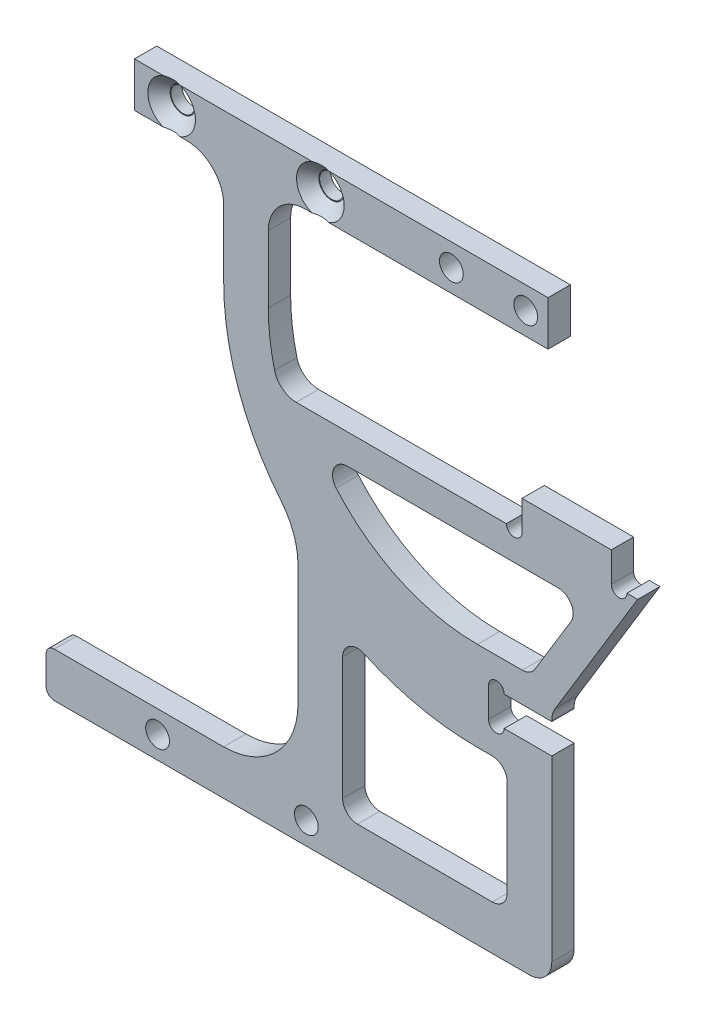
from build123d import *

# Parameters (mm, degrees)
EXTRUDE_1_DEPTH       = 3
EXTRUDE_START         = -3
SKETCH_2_W            = 40
SKETCH_2_H            = 6
EXTRUDE_2_DEPTH       = 3
EXTRUDE_3_DEPTH       = 3
EXTRUDE_4_DEPTH       = 3
CUT_EXTRUDE_1_DEPTH   = 10
SKETCH_7_W            = 12
SKETCH_7_H            = 4
EXTRUDE_5_DEPTH       = 3
SKETCH_8_R            = 1.05
CUT_EXTRUDE_2_DEPTH   = 10
SKETCH_9_W            = 26
SKETCH_9_H            = 6
EXTRUDE_6_DEPTH       = 3
SKETCH_10_R           = 1.6
CUT_EXTRUDE_3_DEPTH   = 10
SKETCH_14_W           = 18
SKETCH_14_H           = 6
EXTRUDE_7_DEPTH       = 3
SKETCH_15_R           = 1.6
CUT_EXTRUDE_4_DEPTH   = 10
FILLET_2_R            = 3
FILLET_3_R            = 3
FILLET_4_R            = 3
FILLET_5_R            = 10
FILLET_6_R            = 1.1
CUT_EXTRUDE_7_DEPTH   = 10
FILLET_8_R            = 2
SKETCH_17_W           = 5.387301628
SKETCH_17_H           = 6
CUT_EXTRUDE_8_DEPTH   = 10
SKETCH_18_W           = 31
SKETCH_18_H           = 6
EXTRUDE_8_DEPTH       = 3
SKETCH_19_R           = 1.6
CUT_EXTRUDE_9_DEPTH   = 10
OTHER_1_OUTLINE_R     = 1.7
OTHER_1_OUTLINE_R_2   = 1.6
OTHER_1_DEPTH         = 1.5
OTHER_1_DRAFT         = -45
OTHER_1_2_OUTLINE_R   = 1.7
OTHER_1_2_OUTLINE_R_2 = 1.6
OTHER_1_2_DEPTH       = 1.5
OTHER_1_2_DRAFT       = -45
SKETCH_23_W           = 5
SKETCH_23_H           = 6
CUT_EXTRUDE_10_DEPTH  = 10
FILLET_9_R            = 5


# Read off the part's stored shape, not the designer's step: 高级异型孔1
with BuildPart() as part:
    # 草图1 → 凸台-拉伸1 (new body)
    with BuildSketch(Plane.XY):
        with BuildLine():
            Line((0, -28.112698372), (10, -28.112698372))
            Line((10, -28.112698372), (10, -34.112698372))
            Line((10, -34.112698372), (0, -34.112698372))
            ThreePointArc((0, -34.112698372), (-24.121320344, -24.121320344), (-34.112698372, 0))
            Line((-34.112698372, 0), (-34.112698372, 20))
            Line((-34.112698372, 20), (-28.112698372, 20))
            Line((-28.112698372, 20), (-28.112698372, 0))
            ThreePointArc((-28.112698372, 0), (-19.878679656, -19.878679656), (0, -28.112698372))
        make_face()
    extrude(amount=EXTRUDE_1_DEPTH)

    # 草图2 → 凸台-拉伸2 (add)
    with BuildSketch(Plane.XY.offset(3).offset(EXTRUDE_START)):
        with BuildLine():
            Line((-24.121320344, -24.121320344), (-24.121320344, -54.112698372))
            Line((-24.121320344, -54.112698372), (-40, -54.112698372))
            Line((-40, -54.112698372), (-40, -60.112698372))
            Line((-40, -60.112698372), (10, -60.112698372))
            Line((10, -60.112698372), (10, -54.112698372))
            Line((10, -54.112698372), (-18.121320344, -54.112698372))
            Line((-18.121320344, -54.112698372), (-18.121320344, -28.901452199))
            ThreePointArc((-18.121320344, -28.901452199), (-21.256118841, -26.680584739), (-24.121320344, -24.121320344))
        make_face()
        with Locations((-31.112698372, 17)):
            Rectangle(SKETCH_2_W, SKETCH_2_H)
    extrude(amount=EXTRUDE_2_DEPTH)

    # 草图4 → 凸台-拉伸3 (add)
    with BuildSketch(Plane(origin=(0, 0, 0), x_dir=(-1, 0, 0), z_dir=(0, 0, -1))):
        with BuildLine():
            Line((-10, -28.112698372), (-21.546473969, -9.112698372))
            Line((-21.546473969, -9.112698372), (26.59478404, -9.112698372))
            ThreePointArc((26.59478404, -9.112698372), (16.342295877, -22.874727872), (0, -28.112698372))
            Line((0, -28.112698372), (-10, -28.112698372))
        make_face()
    extrude(amount=-EXTRUDE_3_DEPTH)

    # 草图6 → 凸台-拉伸4 (add)
    with BuildSketch(Plane.XY.offset(3).offset(EXTRUDE_START)):
        with BuildLine():
            Line((10, -34.112698372), (10, -54.112698372))
            Line((10, -54.112698372), (-18.121320344, -54.112698372))
            Line((-18.121320344, -54.112698372), (-18.121320344, -28.901452199))
            ThreePointArc((-18.121320344, -28.901452199), (-9.427875393, -32.784010673), (0, -34.112698372))
            Line((0, -34.112698372), (10, -34.112698372))
        make_face()
    extrude(amount=EXTRUDE_4_DEPTH)

    # 草图3 → 切除-拉伸1 (cut)
    with BuildSketch(Plane(origin=(0, 0, 0), x_dir=(-1, 0, 0), z_dir=(0, 0, -1))):
        with BuildLine():
            Line((-3.6, -29.112698372), (-10, -29.112698372))
            Line((-10, -29.112698372), (-10, -33.112698372))
            Line((-10, -33.112698372), (-3.6, -33.112698372))
            ThreePointArc((-3.6, -33.112698372), (-2.55, -34.162698372), (-1.5, -33.112698372))
            Line((-1.5, -33.112698372), (-1.5, -29.112698372))
            ThreePointArc((-1.5, -29.112698372), (-2.55, -28.062698372), (-3.6, -29.112698372))
        make_face()
    extrude(amount=-CUT_EXTRUDE_1_DEPTH, mode=Mode.SUBTRACT)

    # 草图7 → 凸台-拉伸5 (add)
    with BuildSketch(Plane(origin=(0, 0, 0), x_dir=(-1, 0, 0), z_dir=(0, 0, -1))):
        with Locations((-12, -7.112698372)):
            Rectangle(SKETCH_7_W, SKETCH_7_H)
    extrude(amount=-EXTRUDE_5_DEPTH)

    # 草图8 → 切除-拉伸2 (cut)
    with BuildSketch(Plane(origin=(0, 0, 0), x_dir=(-1, 0, 0), z_dir=(0, 0, -1))):
        with Locations((-4.95, -9.112698372)):
            Circle(SKETCH_8_R)
        with Locations((-19.05, -9.112698372)):
            Circle(SKETCH_8_R)
    extrude(amount=-CUT_EXTRUDE_2_DEPTH, mode=Mode.SUBTRACT)

    # 草图9 → 凸台-拉伸6 (add)
    with BuildSketch(Plane(origin=(0, 0, 0), x_dir=(-1, 0, 0), z_dir=(0, 0, -1))):
        with Locations((-1.887301628, 17)):
            Rectangle(SKETCH_9_W, SKETCH_9_H)
    extrude(amount=-EXTRUDE_6_DEPTH)

    # 草图10 → 切除-拉伸3 (cut)
    with BuildSketch(Plane(origin=(0, 0, 0), x_dir=(-1, 0, 0), z_dir=(0, 0, -1))):
        with Locations((41.112698372, 17)):
            Circle(SKETCH_10_R)
        with Locations((21.112698372, 17)):
            Circle(SKETCH_10_R)
        with Locations((3.5, 17)):
            Circle(SKETCH_10_R)
        with Locations((-6.5, 17)):
            Circle(SKETCH_10_R)
    extrude(amount=-CUT_EXTRUDE_3_DEPTH, mode=Mode.SUBTRACT)

    # 草图14 → 凸台-拉伸7 (add)
    with BuildSketch(Plane(origin=(0, 0, 0), x_dir=(-1, 0, 0), z_dir=(0, 0, -1))):
        with Locations((49, -57.112698372)):
            Rectangle(SKETCH_14_W, SKETCH_14_H)
    extrude(amount=-EXTRUDE_7_DEPTH)

    # 草图15 → 切除-拉伸4 (cut)
    with BuildSketch(Plane(origin=(0, 0, 0), x_dir=(-1, 0, 0), z_dir=(0, 0, -1))):
        with Locations((43, -57.112698372)):
            Circle(SKETCH_15_R)
        with Locations((23, -57.112698372)):
            Circle(SKETCH_15_R)
    extrude(amount=-CUT_EXTRUDE_4_DEPTH, mode=Mode.SUBTRACT)

    # 圆角2
    fillet_2_edges = [part.edges().sort_by_distance(p)[0] for p in [
        (-26.59478404, -9.112698372, 1.5),
    ]]
    fillet(fillet_2_edges, radius=FILLET_2_R)

    # 圆角3
    fillet_3_edges = [part.edges().sort_by_distance(p)[0] for p in [
        (10, -28.112698372, 1.5),
    ]]
    fillet(fillet_3_edges, radius=FILLET_3_R)

    # 圆角4
    fillet_4_edges = [part.edges().sort_by_distance(p)[0] for p in [
        (10, -60.112698372, 1.5),
    ]]
    fillet(fillet_4_edges, radius=FILLET_4_R)

    # 圆角5
    fillet_5_edges = [part.edges().sort_by_distance(p)[0] for p in [
        (-24.121320344, -24.121320344, 1.5),
        (-24.121320344, -54.112698372, 1.5),
    ]]
    fillet(fillet_5_edges, radius=FILLET_5_R)

    # 圆角6
    fillet_6_edges = [part.edges().sort_by_distance(p)[0] for p in [
        (-58, -60.112698372, 1.5),
        (-58, -54.112698372, 1.5),
    ]]
    fillet(fillet_6_edges, radius=FILLET_6_R)

    # 草图16 → 切除-拉伸7 (cut)
    with BuildSketch(Plane(origin=(0, 0, 0), x_dir=(-1, 0, 0), z_dir=(0, 0, -1))):
        with BuildLine():
            Line((-4, -37.112698372), (0, -37.112698372))
            ThreePointArc((0, -37.112698372), (9.363584206, -35.912054679), (18.121320344, -32.387808346))
            Line((18.121320344, -32.387808346), (18.121320344, -54.112698372))
            Line((18.121320344, -54.112698372), (-4, -54.112698372))
            Line((-4, -54.112698372), (-4, -37.112698372))
        make_face()
        with BuildLine():
            Line((-7.142425951, -25.112698372), (0, -25.112698372))
            ThreePointArc((0, -25.112698372), (12.275023024, -21.908250256), (21.417393888, -13.112698372))
            Line((21.417393888, -13.112698372), (-14.434935826, -13.112698372))
            Line((-14.434935826, -13.112698372), (-7.142425951, -25.112698372))
        make_face()
    extrude(amount=-CUT_EXTRUDE_7_DEPTH, mode=Mode.SUBTRACT)

    # 圆角8
    fillet_8_edges = [part.edges().sort_by_distance(p)[0] for p in [
        (4, -54.112698372, 1.5),
        (4, -37.112698372, 1.5),
        (-18.121320344, -32.387808346, 1.5),
        (-18.121320344, -54.112698372, 1.5),
        (-21.417393888, -13.112698372, 1.5),
        (7.142425951, -25.112698372, 1.5),
        (14.434935826, -13.112698372, 1.5),
    ]]
    fillet(fillet_8_edges, radius=FILLET_8_R)

    # 草图17 → 切除-拉伸8 (cut)
    with BuildSketch(Plane(origin=(0, 0, 0), x_dir=(-1, 0, 0), z_dir=(0, 0, -1))):
        with Locations((-12.193650814, 17)):
            Rectangle(SKETCH_17_W, SKETCH_17_H)
    extrude(amount=-CUT_EXTRUDE_8_DEPTH, mode=Mode.SUBTRACT)

    # 草图18 → 凸台-拉伸8 (add)
    with BuildSketch(Plane(origin=(0, 0, 0), x_dir=(-1, 0, 0), z_dir=(0, 0, -1))):
        with Locations((31.612698372, 17)):
            Rectangle(SKETCH_18_W, SKETCH_18_H)
    extrude(amount=-EXTRUDE_8_DEPTH)

    # 草图19 → 切除-拉伸9 (cut)
    with BuildSketch(Plane(origin=(0, 0, 0), x_dir=(-1, 0, 0), z_dir=(0, 0, -1))):
        with Locations((21.112698372, 17)):
            Circle(SKETCH_19_R)
        with Locations((41.112698372, 17)):
            Circle(SKETCH_19_R)
    extrude(amount=-CUT_EXTRUDE_9_DEPTH, mode=Mode.SUBTRACT)


with BuildPart() as other_1_tool:
    # 高级异型孔1 outline → 高级异型孔1 (with draft: the straight prism first)
    with BuildSketch(Plane.XY.offset(1.5)):
        with Locations((-21.112698372, 17)):
            Circle(OTHER_1_OUTLINE_R)
        with Locations((-21.112698372, 17)):
            Circle(OTHER_1_OUTLINE_R_2, mode=Mode.SUBTRACT)
    extrude(amount=OTHER_1_DEPTH)
    # 高级异型孔1: the draft: its side faces are tilted about the plane it starts from
    other_1_sides = [other_1_tool.faces().sort_by_distance(p)[0] for p in [
        (-22.812698372, 17, 2.25),
        (-22.712698372, 17, 2.25),
    ]]
    draft(other_1_sides, Plane.XY.offset(1.5), OTHER_1_DRAFT)


with BuildPart() as part_1:
    add(part.part)

    # 高级异型孔1: cut by other_1_tool
    add(other_1_tool.part, mode=Mode.SUBTRACT)


with BuildPart() as other_1_2_tool:
    # Other 1 2 outline → Other 1 2 (with draft: the straight prism first)
    with BuildSketch(Plane.XY.offset(1.5)):
        with Locations((-41.112698372, 17)):
            Circle(OTHER_1_2_OUTLINE_R)
        with Locations((-41.112698372, 17)):
            Circle(OTHER_1_2_OUTLINE_R_2, mode=Mode.SUBTRACT)
    extrude(amount=OTHER_1_2_DEPTH)
    # Other 1 2: the draft: its side faces are tilted about the plane it starts from
    other_1_2_sides = [other_1_2_tool.faces().sort_by_distance(p)[0] for p in [
        (-42.812698372, 17, 2.25),
        (-42.712698372, 17, 2.25),
    ]]
    draft(other_1_2_sides, Plane.XY.offset(1.5), OTHER_1_2_DRAFT)


with BuildPart() as part_2:
    add(part_1.part)

    # Other 1 2: cut by other_1_2_tool
    add(other_1_2_tool.part, mode=Mode.SUBTRACT)

    # 草图23 → 切除-拉伸10 (cut)
    with BuildSketch(Plane(origin=(0, 0, 0), x_dir=(-1, 0, 0), z_dir=(0, 0, -1))):
        with Locations((48.612698372, 17)):
            Rectangle(SKETCH_23_W, SKETCH_23_H)
    extrude(amount=-CUT_EXTRUDE_10_DEPTH, mode=Mode.SUBTRACT)

    # 圆角9
    fillet_9_edges = [part_2.edges().sort_by_distance(p)[0] for p in [
        (-28.112698372, 14, 1.5),
        (-34.112698372, 14, 1.5),
    ]]
    fillet(fillet_9_edges, radius=FILLET_9_R)


solid = part_2.part
